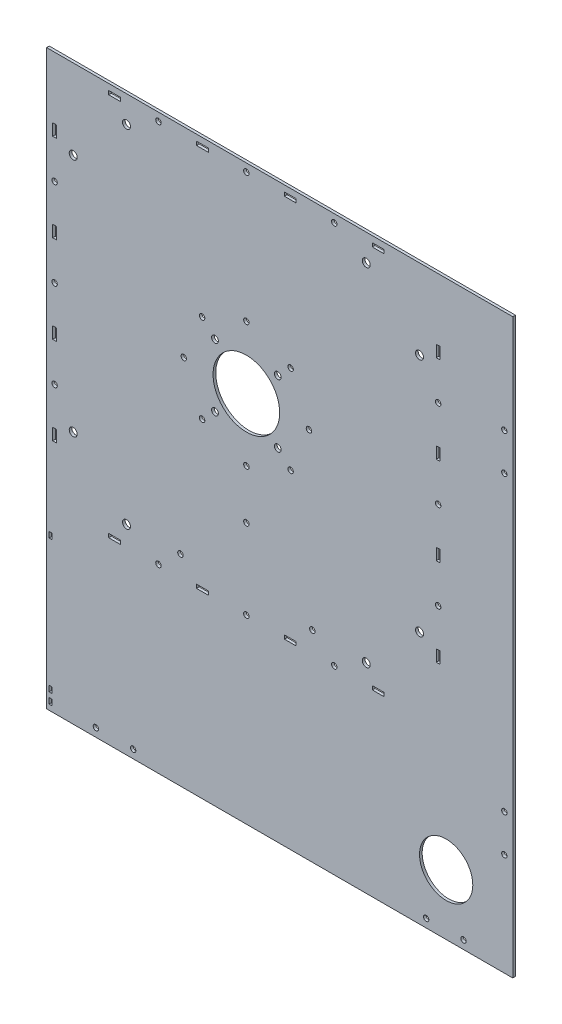
from build123d import *

# Parameters (mm, degrees)
SKETCH_1_R          = 25
SKETCH_1_R_2        = 2.55
EXTRUDE_1_DEPTH     = 2
SKETCH_3_R          = 2.05
SKETCH_3_W          = 8.8
SKETCH_3_H          = 2.8
SKETCH_3_W_2        = 2.8
SKETCH_3_H_2        = 8.8
CUT_EXTRUDE_2_DEPTH = 4
SKETCH_7_R          = 3
CUT_EXTRUDE_3_DEPTH = 10
SKETCH_9_R          = 20
SKETCH_9_R_2        = 2
SKETCH_9_W          = 2.3
SKETCH_9_H          = 4.3
EXTRUDE_3_DEPTH     = 2


with BuildPart() as part:
    # 草图1 → 凸台-拉伸1 (new body)
    with BuildSketch(Plane.XY):
        Polygon((151.457142857, -41.187142857), (151.457142857, 108.812857143), (-148.542857143, 108.812857143), (-148.542857143, -191.187142857), (151.457142857, -191.187142857), align=None)
        with Locations((1.457142857, -41.187142857)):
            Circle(SKETCH_1_R, mode=Mode.SUBTRACT)
        with Locations((25.027142857, -17.617142857)):
            Circle(SKETCH_1_R_2, mode=Mode.SUBTRACT)
        with Locations((25.027142857, -64.757142857)):
            Circle(SKETCH_1_R_2, mode=Mode.SUBTRACT)
        with Locations((-22.112857143, -64.757142857)):
            Circle(SKETCH_1_R_2, mode=Mode.SUBTRACT)
        with Locations((-22.112857143, -17.617142857)):
            Circle(SKETCH_1_R_2, mode=Mode.SUBTRACT)
    extrude(amount=EXTRUDE_1_DEPTH)

    # 草图3 → 切除-拉伸2 (cut)
    with BuildSketch(Plane.XY.offset(2)):
        with Locations((1.457142857, -185.187142857)):
            Circle(SKETCH_3_R)
        with Locations((67.457142857, -185.187142857)):
            Circle(SKETCH_3_R)
        with Locations((-64.542857143, -185.187142857)):
            Circle(SKETCH_3_R)
        with Locations((-142.542857143, 24.812857143)):
            Circle(SKETCH_3_R)
        with Locations((-142.542857143, -41.187142857)):
            Circle(SKETCH_3_R)
        with Locations((-142.542857143, -107.187142857)):
            Circle(SKETCH_3_R)
        with Locations((67.457142857, 102.812857143)):
            Circle(SKETCH_3_R)
        with Locations((1.457142857, 102.812857143)):
            Circle(SKETCH_3_R)
        with Locations((-64.542857143, 102.812857143)):
            Circle(SKETCH_3_R)
        with Locations((145.457142857, -107.187142857)):
            Circle(SKETCH_3_R)
        with Locations((145.457142857, -41.187142857)):
            Circle(SKETCH_3_R)
        with Locations((145.457142857, 24.812857143)):
            Circle(SKETCH_3_R)
        with Locations((50.957142857, -170.187142857)):
            Circle(SKETCH_3_R)
        with Locations((-48.042857143, -170.187142857)):
            Circle(SKETCH_3_R)
        with Locations((1.457142857, -88.187142857)):
            Circle(SKETCH_3_R)
        with Locations((-31.776875859, -74.421161573)):
            Circle(SKETCH_3_R)
        with Locations((-45.542857143, -41.187142857)):
            Circle(SKETCH_3_R)
        with Locations((-31.776875859, -7.953124141)):
            Circle(SKETCH_3_R)
        with Locations((1.457142857, 5.812857143)):
            Circle(SKETCH_3_R)
        with Locations((34.691161573, -7.953124141)):
            Circle(SKETCH_3_R)
        with Locations((48.457142857, -41.187142857)):
            Circle(SKETCH_3_R)
        with Locations((34.691161573, -74.421161573)):
            Circle(SKETCH_3_R)
        with Locations((1.457142857, -125.187142857)):
            Circle(SKETCH_3_R)
        with Locations((100.457142857, -185.187142857)):
            Rectangle(SKETCH_3_W, SKETCH_3_H)
        with Locations((34.457142857, -185.187142857)):
            Rectangle(SKETCH_3_W, SKETCH_3_H)
        with Locations((-31.542857143, -185.187142857)):
            Rectangle(SKETCH_3_W, SKETCH_3_H)
        with Locations((-97.542857143, -185.187142857)):
            Rectangle(SKETCH_3_W, SKETCH_3_H)
        with Locations((-142.542857143, 57.812857143)):
            Rectangle(SKETCH_3_W_2, SKETCH_3_H_2)
        with Locations((-142.542857143, -8.187142857)):
            Rectangle(SKETCH_3_W_2, SKETCH_3_H_2)
        with Locations((-142.542857143, -74.187142857)):
            Rectangle(SKETCH_3_W_2, SKETCH_3_H_2)
        with Locations((-142.542857143, -140.187142857)):
            Rectangle(SKETCH_3_W_2, SKETCH_3_H_2)
        with Locations((100.457142857, 102.812857143)):
            Rectangle(SKETCH_3_W, SKETCH_3_H)
        with Locations((34.457142857, 102.812857143)):
            Rectangle(SKETCH_3_W, SKETCH_3_H)
        with Locations((-31.542857143, 102.812857143)):
            Rectangle(SKETCH_3_W, SKETCH_3_H)
        with Locations((-97.542857143, 102.812857143)):
            Rectangle(SKETCH_3_W, SKETCH_3_H)
        with Locations((145.457142857, -140.187142857)):
            Rectangle(SKETCH_3_W_2, SKETCH_3_H_2)
        with Locations((145.457142857, -74.187142857)):
            Rectangle(SKETCH_3_W_2, SKETCH_3_H_2)
        with Locations((145.457142857, -8.187142857)):
            Rectangle(SKETCH_3_W_2, SKETCH_3_H_2)
        with Locations((145.457142857, 57.812857143)):
            Rectangle(SKETCH_3_W_2, SKETCH_3_H_2)
    extrude(amount=-CUT_EXTRUDE_2_DEPTH, mode=Mode.SUBTRACT)

    # 草图7 → 切除-拉伸3 (cut)
    with BuildSketch(Plane.XY.offset(2)):
        with Locations((-88.542857143, -171.187142857)):
            Circle(SKETCH_7_R)
        with Locations((91.457142857, -171.187142857)):
            Circle(SKETCH_7_R)
        with Locations((-128.542857143, 48.812857143)):
            Circle(SKETCH_7_R)
        with Locations((-128.542857143, -131.187142857)):
            Circle(SKETCH_7_R)
        with Locations((91.457142857, 88.812857143)):
            Circle(SKETCH_7_R)
        with Locations((-88.542857143, 88.812857143)):
            Circle(SKETCH_7_R)
        with Locations((131.457142857, -131.187142857)):
            Circle(SKETCH_7_R)
        with Locations((131.457142857, 48.812857143)):
            Circle(SKETCH_7_R)
    extrude(amount=-CUT_EXTRUDE_3_DEPTH, mode=Mode.SUBTRACT)

    # 草图9 → 凸台-拉伸3 (add)
    with BuildSketch(Plane.XY.offset(2)):
        Polygon((151.457142857, 108.812857143), (201.457142857, 108.812857143), (201.457142857, -191.187142857), (201.457142857, -321.187142857), (-148.542857143, -321.187142857), (-148.542857143, -191.187142857), (151.457142857, -191.187142857), align=None)
        with Locations((151.457142857, -275.799903925)):
            Circle(SKETCH_9_R, mode=Mode.SUBTRACT)
        with Locations((-111.542857143, -314.887142857)):
            Circle(SKETCH_9_R_2, mode=Mode.SUBTRACT)
        with Locations((-83.542857143, -314.887142857)):
            Circle(SKETCH_9_R_2, mode=Mode.SUBTRACT)
        with Locations((136.457142857, -314.887142857)):
            Circle(SKETCH_9_R_2, mode=Mode.SUBTRACT)
        with Locations((164.457142857, -314.887142857)):
            Circle(SKETCH_9_R_2, mode=Mode.SUBTRACT)
        with Locations((195.157142857, -244.187142857)):
            Circle(SKETCH_9_R_2, mode=Mode.SUBTRACT)
        with Locations((195.157142857, -216.187142857)):
            Circle(SKETCH_9_R_2, mode=Mode.SUBTRACT)
        with Locations((195.157142857, 3.812857143)):
            Circle(SKETCH_9_R_2, mode=Mode.SUBTRACT)
        with Locations((195.157142857, 31.812857143)):
            Circle(SKETCH_9_R_2, mode=Mode.SUBTRACT)
        with Locations((-145.592857143, -315.037142857)):
            Rectangle(SKETCH_9_W, SKETCH_9_H, mode=Mode.SUBTRACT)
        with Locations((-145.592857143, -307.037142857)):
            Rectangle(SKETCH_9_W, SKETCH_9_H, mode=Mode.SUBTRACT)
        with Locations((-145.592857143, -207.037142857)):
            Rectangle(SKETCH_9_W, SKETCH_9_H, mode=Mode.SUBTRACT)
    extrude(amount=-EXTRUDE_3_DEPTH)


solid = part.part
